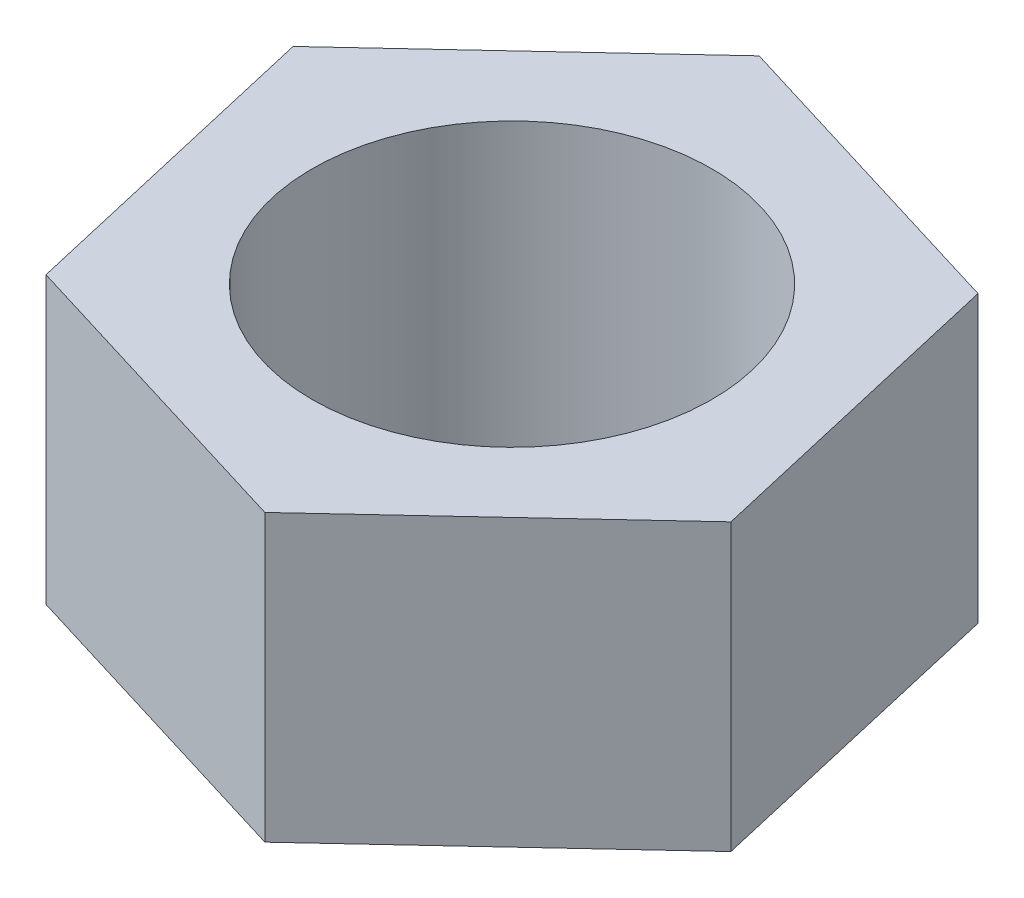
from build123d import *

# Parameters (mm, degrees)
SKETCH_1_R      = 7
EXTRUDE_1_DEPTH = 10


with BuildPart() as part:
    # Эскиз1 → Вытянуть1 (new body)
    with BuildSketch(Plane(origin=(0, 0, 0), x_dir=(1, 0, 0), z_dir=(0, 1, 0))):
        Polygon((2.596453934, -11.251300383), (11.042138924, -3.377055124), (8.44568499, 7.874245258), (-2.596453934, 11.251300383), (-11.042138924, 3.377055124), (-8.44568499, -7.874245258), align=None)
        Circle(SKETCH_1_R, mode=Mode.SUBTRACT)
    extrude(amount=EXTRUDE_1_DEPTH)


solid = part.part
